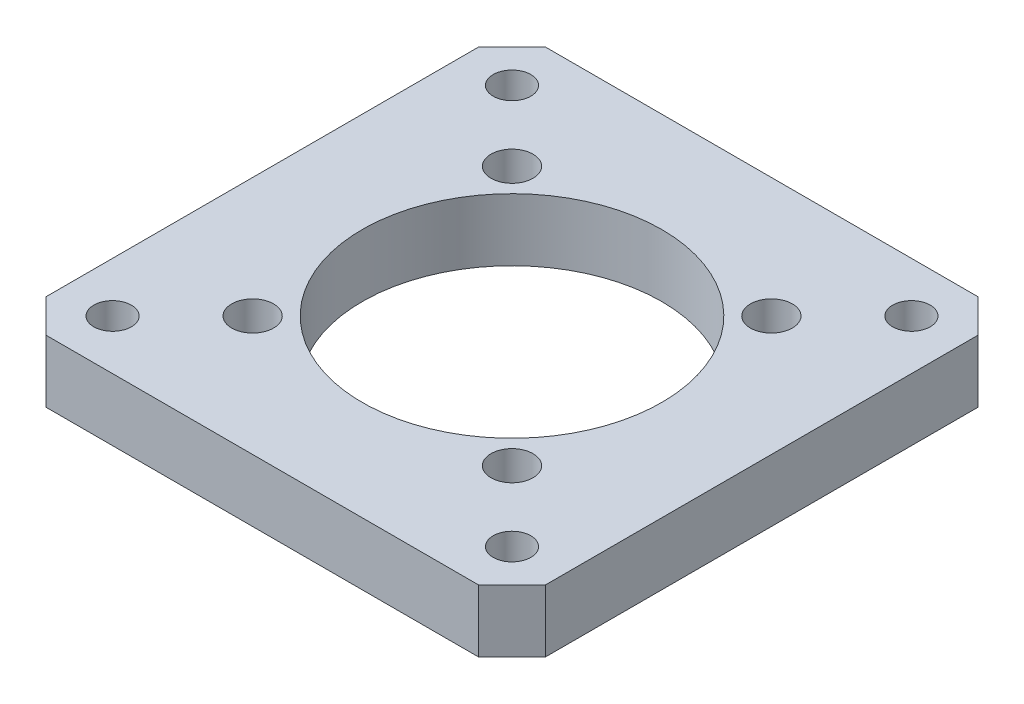
from build123d import *

# Parameters (mm, degrees)
SKETCH1_W           = 38.1
SKETCH1_H           = 38.1
SKETCH1_R           = 11.43
BOSS_EXTRUDE1_DEPTH = 4.7625
SKETCH2_R           = 1.6002
SKETCH2_R_2         = 1.4351
CUT_EXTRUDE1_DEPTH  = 28.358479604
CIRPATTERN1_COUNT   = 4
CHAMFER1_SIZE       = 2.54


with BuildPart() as part:
    # Sketch1 → Boss-Extrude1 (new body)
    with BuildSketch(Plane(origin=(0, 0, 0), x_dir=(1, 0, 0), z_dir=(0, 1, 0))):
        Rectangle(SKETCH1_W, SKETCH1_H)
        Circle(SKETCH1_R, mode=Mode.SUBTRACT)
    extrude(amount=BOSS_EXTRUDE1_DEPTH)

    # Sketch2 → Cut-Extrude1 (cut, through all)
    with BuildSketch(Plane(origin=(0, 4.7625, 0), x_dir=(1, 0, 0), z_dir=(0, 1, 0))):
        with Locations((9.896242245, 9.896242245)):
            Circle(SKETCH2_R)
        with Locations((15.24, 15.24)):
            Circle(SKETCH2_R_2)
    cut_extrude1 = extrude(amount=-CUT_EXTRUDE1_DEPTH, mode=Mode.SUBTRACT)

    # CirPattern1: Cut-Extrude1 ×4 about axis
    cirpattern1_axis = Axis((0, 4.7625, 0), (0, -1, 0))
    for i in range(1, CIRPATTERN1_COUNT):
        add(cut_extrude1.rotate(cirpattern1_axis, i * 360 / CIRPATTERN1_COUNT), mode=Mode.SUBTRACT)

    # Chamfer1
    chamfer1_edges = [part.edges().sort_by_distance(p)[0] for p in [
        (-19.05, 2.38125, 19.05),
        (19.05, 2.38125, 19.05),
        (19.05, 2.38125, -19.05),
        (-19.05, 2.38125, -19.05),
    ]]
    chamfer(chamfer1_edges, length=CHAMFER1_SIZE)


solid = part.part
